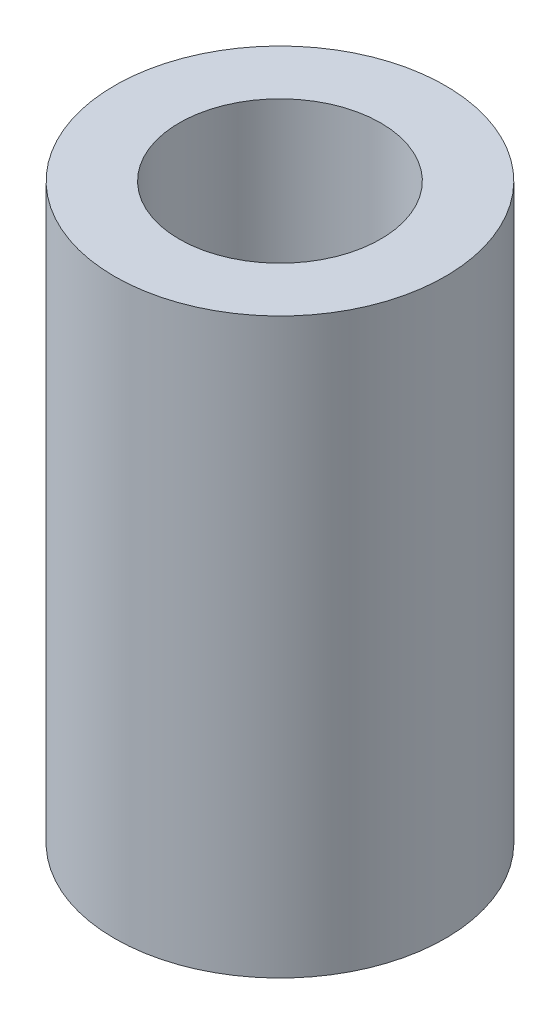
from build123d import *

# Parameters (mm, degrees)
SKETCH2_R      = 44.831
SKETCH2_R_2    = 27.305
EXTRUDE1_DEPTH = 155.43777777


with BuildPart() as part:
    # Sketch2 → Extrude1 (new body)
    with BuildSketch(Plane(origin=(0, 0, 0), x_dir=(1, 0, 0), z_dir=(0, 1, 0))):
        Circle(SKETCH2_R)
        Circle(SKETCH2_R_2, mode=Mode.SUBTRACT)
    extrude(amount=EXTRUDE1_DEPTH)


solid = part.part
